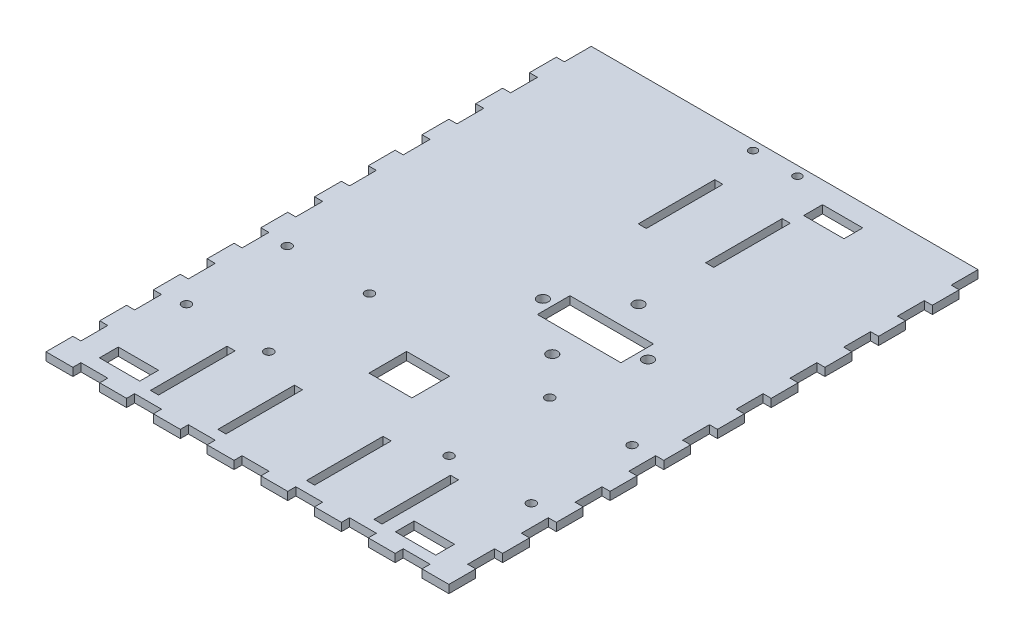
from build123d import *

# Parameters (mm, degrees)
MDFESB_W          = 150
MDFESB_H          = 200
MDF_DEPTH         = 3
LDRESB_W          = 3
LDRESB_H          = 28.5
LDRESB_W_2        = 15
LDRESB_H_2        = 7
LDRBURACOS_DEPTH  = 3
CORESB_R          = 2
CORESB_W          = 31.12
CORESB_H          = 12.13
CORBURACOS_DEPTH  = 3
ENCAIXESESB_W     = 10
ENCAIXESESB_H     = 3
ENCAIXESESB_W_2   = 3
ENCAIXESESB_H_2   = 10
ENCAIXE_DEPTH     = 3
ACOPLMOTORESB_R   = 1.65
ACOPLMOTORESB_W   = 16
ACOPLMOTORESB_H   = 14
ACOPLMOTOR_DEPTH  = 3
CASTERFUROSESB_R  = 1.5
CASTERFUROS_DEPTH = 3


with BuildPart() as part:
    # mdfEsb → mdf (new body)
    with BuildSketch(Plane(origin=(0, 0, 0), x_dir=(1, 0, 0), z_dir=(0, 1, 0))):
        with Locations((75, 100)):
            Rectangle(MDFESB_W, MDFESB_H)
    extrude(amount=MDF_DEPTH)

    # ldrEsb → ldrBuracos (cut)
    with BuildSketch(Plane(origin=(0, 3, 0), x_dir=(1, 0, 0), z_dir=(0, 1, 0))):
        with Locations((33.4, 21.25)):
            Rectangle(LDRESB_W, LDRESB_H)
        with Locations((58.5, 21.25)):
            Rectangle(LDRESB_W, LDRESB_H)
        with Locations((91.5, 21.25)):
            Rectangle(LDRESB_W, LDRESB_H)
        with Locations((116.6, 21.25)):
            Rectangle(LDRESB_W, LDRESB_H)
        with Locations((70.5, 165.75)):
            Rectangle(LDRESB_W, LDRESB_H)
        with Locations((95.6, 165.75)):
            Rectangle(LDRESB_W, LDRESB_H)
        with Locations((130.6, 10.5)):
            Rectangle(LDRESB_W_2, LDRESB_H_2)
        with Locations((19.4, 11.5)):
            Rectangle(LDRESB_W_2, LDRESB_H_2)
        with Locations((104.6, 188.5)):
            Rectangle(LDRESB_W_2, LDRESB_H_2)
    extrude(amount=-LDRBURACOS_DEPTH, mode=Mode.SUBTRACT)

    # corEsb → corBuracos (cut)
    with BuildSketch(Plane(origin=(0, 3, 0), x_dir=(1, 0, 0), z_dir=(0, 1, 0))):
        with Locations((95, 125.63)):
            Circle(CORESB_R)
        with Locations((95, 93.5)):
            Circle(CORESB_R)
        with Locations((114.56, 109.565)):
            Circle(CORESB_R)
        with Locations((75.44, 109.565)):
            Circle(CORESB_R)
        with Locations((95, 109.565)):
            Rectangle(CORESB_W, CORESB_H)
    extrude(amount=-CORBURACOS_DEPTH, mode=Mode.SUBTRACT)

    # EncaixesEsb → Encaixe (cut)
    with BuildSketch(Plane(origin=(0, 3, 0), x_dir=(1, 0, 0), z_dir=(0, 1, 0))):
        with Locations((15, 1.5)):
            Rectangle(ENCAIXESESB_W, ENCAIXESESB_H)
        with Locations((1.5, 35)):
            Rectangle(ENCAIXESESB_W_2, ENCAIXESESB_H_2)
        with Locations((1.5, 15)):
            Rectangle(ENCAIXESESB_W_2, ENCAIXESESB_H_2)
        with Locations((1.5, 55)):
            Rectangle(ENCAIXESESB_W_2, ENCAIXESESB_H_2)
        with Locations((1.5, 75)):
            Rectangle(ENCAIXESESB_W_2, ENCAIXESESB_H_2)
        with Locations((1.5, 95)):
            Rectangle(ENCAIXESESB_W_2, ENCAIXESESB_H_2)
        with Locations((1.5, 115)):
            Rectangle(ENCAIXESESB_W_2, ENCAIXESESB_H_2)
        with Locations((1.5, 135)):
            Rectangle(ENCAIXESESB_W_2, ENCAIXESESB_H_2)
        with Locations((1.5, 155)):
            Rectangle(ENCAIXESESB_W_2, ENCAIXESESB_H_2)
        with Locations((1.5, 175)):
            Rectangle(ENCAIXESESB_W_2, ENCAIXESESB_H_2)
        with Locations((1.5, 195)):
            Rectangle(ENCAIXESESB_W_2, ENCAIXESESB_H_2)
        with Locations((35, 1.5)):
            Rectangle(ENCAIXESESB_W, ENCAIXESESB_H)
        with Locations((55, 1.5)):
            Rectangle(ENCAIXESESB_W, ENCAIXESESB_H)
        with Locations((75, 1.5)):
            Rectangle(ENCAIXESESB_W, ENCAIXESESB_H)
        with Locations((95, 1.5)):
            Rectangle(ENCAIXESESB_W, ENCAIXESESB_H)
        with Locations((115, 1.5)):
            Rectangle(ENCAIXESESB_W, ENCAIXESESB_H)
        with Locations((135, 1.5)):
            Rectangle(ENCAIXESESB_W, ENCAIXESESB_H)
        with Locations((148.5, 35)):
            Rectangle(ENCAIXESESB_W_2, ENCAIXESESB_H_2)
        with Locations((148.5, 15)):
            Rectangle(ENCAIXESESB_W_2, ENCAIXESESB_H_2)
        with Locations((148.5, 55)):
            Rectangle(ENCAIXESESB_W_2, ENCAIXESESB_H_2)
        with Locations((148.5, 75)):
            Rectangle(ENCAIXESESB_W_2, ENCAIXESESB_H_2)
        with Locations((148.5, 95)):
            Rectangle(ENCAIXESESB_W_2, ENCAIXESESB_H_2)
        with Locations((148.5, 115)):
            Rectangle(ENCAIXESESB_W_2, ENCAIXESESB_H_2)
        with Locations((148.5, 135)):
            Rectangle(ENCAIXESESB_W_2, ENCAIXESESB_H_2)
        with Locations((148.5, 155)):
            Rectangle(ENCAIXESESB_W_2, ENCAIXESESB_H_2)
        with Locations((148.5, 175)):
            Rectangle(ENCAIXESESB_W_2, ENCAIXESESB_H_2)
        with Locations((148.5, 195)):
            Rectangle(ENCAIXESESB_W_2, ENCAIXESESB_H_2)
    extrude(amount=-ENCAIXE_DEPTH, mode=Mode.SUBTRACT)

    # AcoplMotorEsb → AcoplMotor (cut)
    with BuildSketch(Plane(origin=(0, 3, 0), x_dir=(1, 0, 0), z_dir=(0, 1, 0))):
        with Locations((108.56, 41.5)):
            Circle(ACOPLMOTORESB_R)
        with Locations((108.56, 79)):
            Circle(ACOPLMOTORESB_R)
        with Locations((139.2, 41.5)):
            Circle(ACOPLMOTORESB_R)
        with Locations((139.2, 79)):
            Circle(ACOPLMOTORESB_R)
        with Locations((10.8, 79)):
            Circle(ACOPLMOTORESB_R)
        with Locations((10.8, 41.5)):
            Circle(ACOPLMOTORESB_R)
        with Locations((41.44, 79)):
            Circle(ACOPLMOTORESB_R)
        with Locations((41.44, 41.5)):
            Circle(ACOPLMOTORESB_R)
        with Locations((75, 60.25)):
            Rectangle(ACOPLMOTORESB_W, ACOPLMOTORESB_H)
    extrude(amount=-ACOPLMOTOR_DEPTH, mode=Mode.SUBTRACT)

    # CasterFurosEsb → CasterFuros (cut)
    with BuildSketch(Plane(origin=(0, 3, 0), x_dir=(1, 0, 0), z_dir=(0, 1, 0))):
        with Locations((66.75, 196.5)):
            Circle(CASTERFUROSESB_R)
        with Locations((83.25, 196.5)):
            Circle(CASTERFUROSESB_R)
    extrude(amount=-CASTERFUROS_DEPTH, mode=Mode.SUBTRACT)


solid = part.part
